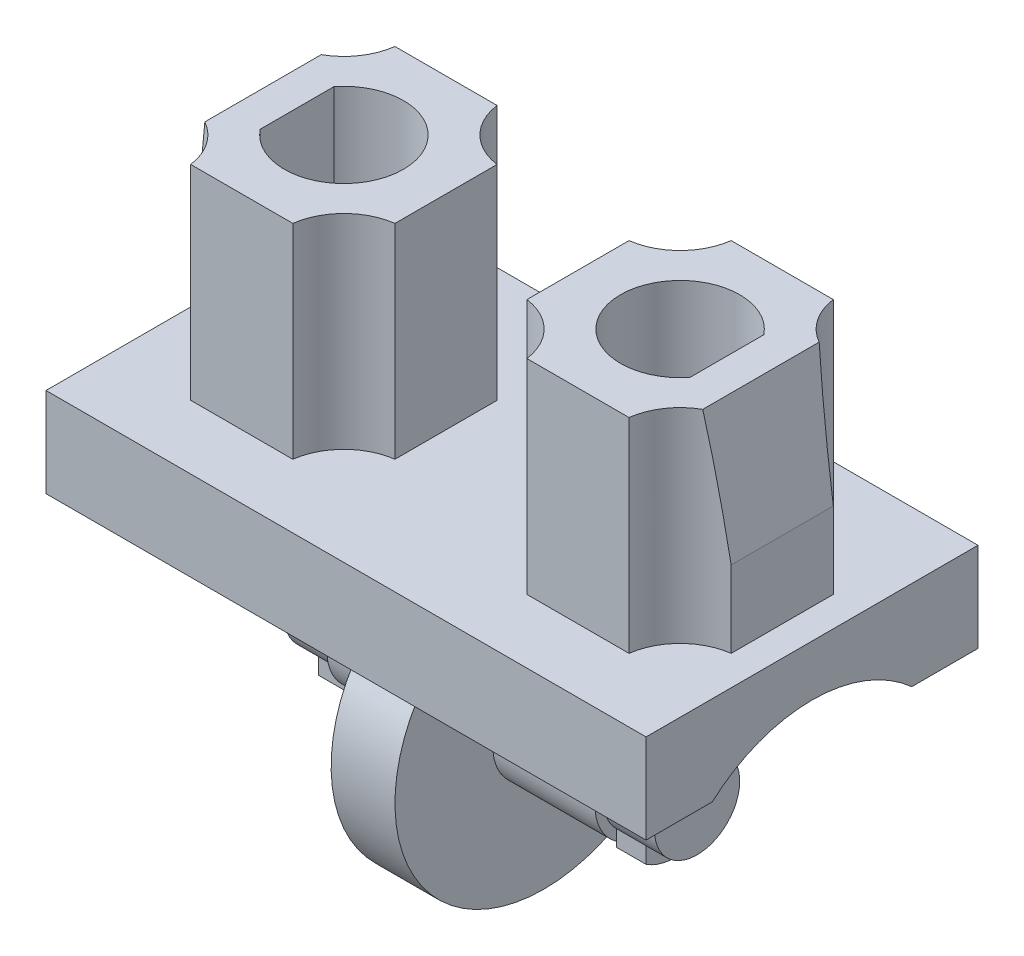
from build123d import *

# Parameters (mm, degrees)
SALIENTE_EXTRUIR1_DEPTH = 7.05
SALIENTE_EXTRUIR2_DEPTH = 0.75
CROQUIS2_R              = 1.2
SALIENTE_EXTRUIR3_DEPTH = 2.4
CROQUIS3_R              = 1
SALIENTE_EXTRUIR4_DEPTH = 1.2
CORTAR_EXTRUIR1_REACH   = 16.574
SALIENTE_EXTRUIR5_DEPTH = 0.7
SALIENTE_EXTRUIR6_DEPTH = 4.8
CORTAR_EXTRUIR2_DEPTH   = 4.8
CORTAR_EXTRUIR4_DEPTH   = 4.8


with BuildPart() as part:
    # Croquis1 → Saliente-Extruir1 (new, symmetric)
    with BuildSketch(Plane(origin=(0, 0, 0), x_dir=(0, 0, -1), z_dir=(1, 0, 0))):
        with BuildLine():
            ThreePointArc((-2.343074903, -2.1), (0, -1.2), (2.343074903, -2.1))
            Line((2.343074903, -2.1), (3.9, -2.1))
            Line((3.9, -2.1), (3.9, 0))
            Line((3.9, 0), (-3.9, 0))
            Line((-3.9, 0), (-3.9, -2.1))
            Line((-3.9, -2.1), (-2.343074903, -2.1))
        make_face()
    extrude(amount=SALIENTE_EXTRUIR1_DEPTH, both=True)

    # Croquis1<3> → Saliente-Extruir2 (add, symmetric)
    with BuildSketch(Plane(origin=(0, 0, 0), x_dir=(0, 0, -1), z_dir=(1, 0, 0))):
        with BuildLine():
            ThreePointArc((3.5, -4.7), (3.197714978, -3.277108957), (2.343074903, -2.1))
            ThreePointArc((2.343074903, -2.1), (0, -1.2), (-2.343074903, -2.1))
            ThreePointArc((-2.343074903, -2.1), (-1.422891043, -7.897714978), (3.5, -4.7))
        make_face()
    extrude(amount=SALIENTE_EXTRUIR2_DEPTH, both=True)

    # Croquis2 → Saliente-Extruir3 (add)
    with BuildSketch(Plane(origin=(0.75, 0, 0), x_dir=(0, 0, -1), z_dir=(1, 0, 0))):
        with Locations((0, -4.7)):
            Circle(CROQUIS2_R)
    saliente_extruir3 = extrude(amount=SALIENTE_EXTRUIR3_DEPTH)

    # Croquis3 → Saliente-Extruir4 (add)
    with BuildSketch(Plane(origin=(3.15, 0, 0), x_dir=(0, 0, -1), z_dir=(1, 0, 0))):
        with Locations((0, -4.7)):
            Circle(CROQUIS3_R)
    saliente_extruir4 = extrude(amount=SALIENTE_EXTRUIR4_DEPTH)

    # Croquis4 → Cortar-Extruir1 (cut, up to next)
    with BuildSketch(Plane(origin=(4.35, 0, 0), x_dir=(0, 0, -1), z_dir=(1, 0, 0)), mode=Mode.PRIVATE) as cortar_extruir1_sk1:
        with BuildLine():
            Line((-0.661437828, -3.95), (0.661437828, -3.95))
            ThreePointArc((0.661437828, -3.95), (0, -3.7), (-0.661437828, -3.95))
        make_face()
    cortar_extruir1_tool1 = extrude(cortar_extruir1_sk1.sketch, amount=-CORTAR_EXTRUIR1_REACH, mode=Mode.PRIVATE) & part.part
    cortar_extruir1 = cortar_extruir1_tool1.solids().sort_by_distance((4.35, -3.848845, 0))[0]
    add(cortar_extruir1, mode=Mode.SUBTRACT)

    # Croquis5 → Saliente-Extruir5 (add)
    with BuildSketch(Plane(origin=(3.15, 0, 0), x_dir=(0, 0, -1), z_dir=(1, 0, 0))):
        with BuildLine():
            ThreePointArc((0.7, -5.414142843), (0, -5.7), (-0.7, -5.414142843))
            Line((-0.7, -5.414142843), (-0.7, -5.794142843))
            ThreePointArc((-0.7, -5.794142843), (0, -5.99890283), (0.7, -5.794142843))
            Line((0.7, -5.794142843), (0.7, -5.414142843))
        make_face()
    saliente_extruir5 = extrude(amount=SALIENTE_EXTRUIR5_DEPTH)

    # Croquis6 → Saliente-Extruir6 (add)
    with BuildSketch(Plane(origin=(0, 0, 0), x_dir=(1, 0, 0), z_dir=(0, 1, 0))):
        with BuildLine():
            Line((2.75, -2.4), (5.15, -2.4))
            ThreePointArc((5.15, -2.4), (5.547451294, -1.597451294), (6.35, -1.2))
            Line((6.35, -1.2), (6.35, 1.2))
            ThreePointArc((6.35, 1.2), (5.547451294, 1.597451294), (5.15, 2.4))
            Line((5.15, 2.4), (2.75, 2.4))
            ThreePointArc((2.75, 2.4), (2.352548706, 1.597451294), (1.55, 1.2))
            Line((1.55, 1.2), (1.55, -1.2))
            ThreePointArc((1.55, -1.2), (2.352548706, -1.597451294), (2.75, -2.4))
        make_face()
    saliente_extruir6 = extrude(amount=SALIENTE_EXTRUIR6_DEPTH)

    # Croquis7 → Cortar-Extruir2 (cut)
    with BuildSketch(Plane(origin=(0, 4.8, 0), x_dir=(1, 0, 0), z_dir=(0, 1, 0))):
        with BuildLine():
            ThreePointArc((5.05, 0.866025404), (2.55, 0), (5.05, -0.866025404))
            Line((5.05, -0.866025404), (5.05, 0.866025404))
        make_face()
    cortar_extruir2 = extrude(amount=-CORTAR_EXTRUIR2_DEPTH, mode=Mode.SUBTRACT)

    # Croquis8 → Cortar-Extruir4 (cut)
    with BuildSketch(Plane.XY.offset(2.4)):
        Polygon((5.85, 4.8), (6.35, 1.8), (6.35, 4.8), align=None)
    cortar_extruir4 = extrude(amount=-CORTAR_EXTRUIR4_DEPTH, mode=Mode.SUBTRACT)

    # Simetría1: Saliente-Extruir3, Saliente-Extruir4, Cortar-Extruir1, Saliente-Extruir5, Saliente-Extruir6, Cortar-Extruir2, Cortar-Extruir4 across plane
    add(saliente_extruir3.mirror(Plane(origin=(0, 0, 0), x_dir=(0, 0, 1), z_dir=(1, 0, 0))))
    add(saliente_extruir4.mirror(Plane(origin=(0, 0, 0), x_dir=(0, 0, 1), z_dir=(1, 0, 0))))
    add(cortar_extruir1.mirror(Plane(origin=(0, 0, 0), x_dir=(0, 0, 1), z_dir=(1, 0, 0))), mode=Mode.SUBTRACT)
    add(saliente_extruir5.mirror(Plane(origin=(0, 0, 0), x_dir=(0, 0, 1), z_dir=(1, 0, 0))))
    add(saliente_extruir6.mirror(Plane(origin=(0, 0, 0), x_dir=(0, 0, 1), z_dir=(1, 0, 0))))
    add(cortar_extruir2.mirror(Plane(origin=(0, 0, 0), x_dir=(0, 0, 1), z_dir=(1, 0, 0))), mode=Mode.SUBTRACT)
    add(cortar_extruir4.mirror(Plane(origin=(0, 0, 0), x_dir=(0, 0, 1), z_dir=(1, 0, 0))), mode=Mode.SUBTRACT)


solid = part.part
